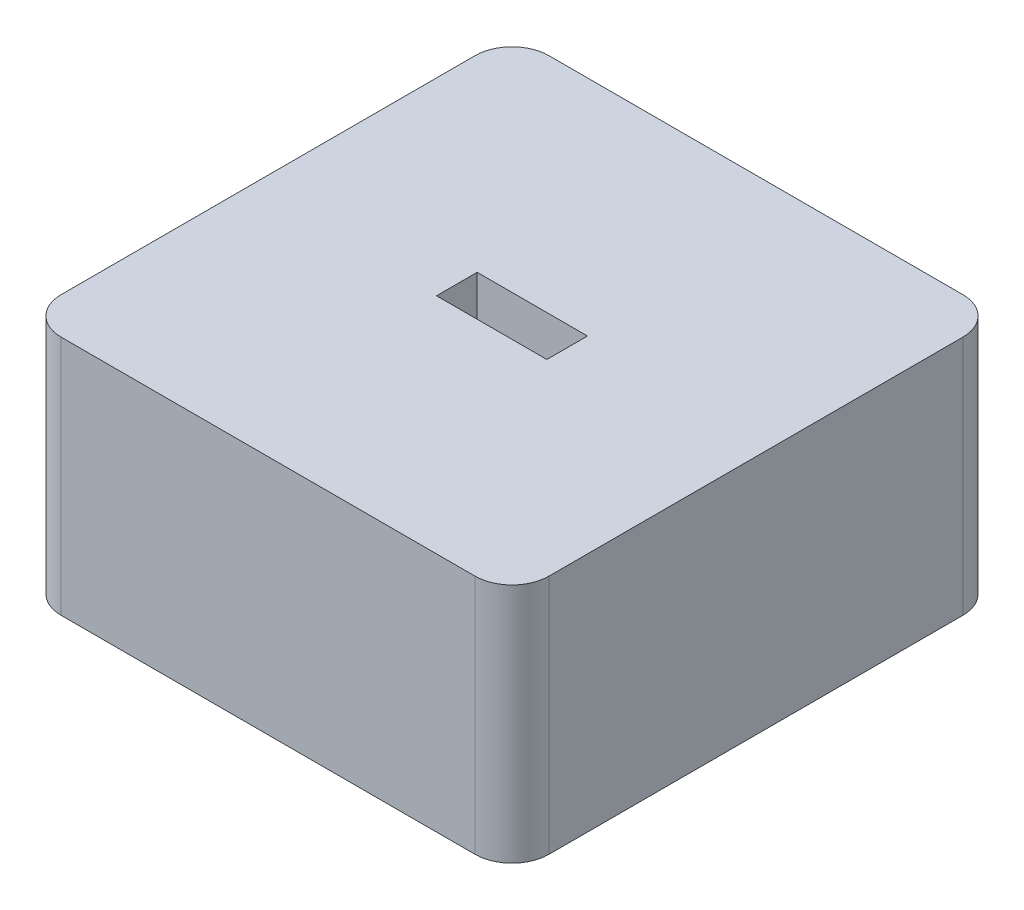
from build123d import *

# Parameters (mm, degrees)
SKETCH1_W           = 42
SKETCH1_H           = 42
BOSS_EXTRUDE1_DEPTH = 20.75
SKETCH2_W           = 9.5
SKETCH2_H           = 3.5
CUT_EXTRUDE4_DEPTH  = 3.52
SKETCH3_W           = 15.5
SKETCH3_H           = 10.5
CUT_EXTRUDE1_DEPTH  = 15.23
CUT_EXTRUDE2_REACH  = 63.846
SKETCH5_W           = 34
SKETCH5_H           = 34
SKETCH5_W_2         = 21.5
SKETCH5_H_2         = 16.5
CUT_EXTRUDE5_DEPTH  = 10
FILLET1_R           = 3.175


with BuildPart() as part:
    # Sketch1 → Boss-Extrude1 (new body)
    with BuildSketch(Plane(origin=(0, 0, 0), x_dir=(1, 0, 0), z_dir=(0, 1, 0))):
        with Locations((21, 21)):
            Rectangle(SKETCH1_W, SKETCH1_H)
    extrude(amount=BOSS_EXTRUDE1_DEPTH)

    # Sketch2 → Cut-Extrude4 (cut)
    with BuildSketch(Plane(origin=(0, 20.75, 0), x_dir=(1, 0, 0), z_dir=(0, 1, 0))):
        with Locations((21, 21)):
            Rectangle(SKETCH2_W, SKETCH2_H)
    extrude(amount=-CUT_EXTRUDE4_DEPTH, mode=Mode.SUBTRACT)

    # Sketch3 → Cut-Extrude1 (cut)
    with BuildSketch(Plane.XZ):
        with Locations((21, -21)):
            Rectangle(SKETCH3_W, SKETCH3_H)
    extrude(amount=-CUT_EXTRUDE1_DEPTH, mode=Mode.SUBTRACT)

    # Sketch4 → Cut-Extrude2 (cut, up to next)
    with BuildSketch(Plane(origin=(0, 17.23, 0), x_dir=(1, 0, 0), z_dir=(0, 1, 0)), mode=Mode.PRIVATE) as cut_extrude2_sk1:
        with BuildLine():
            Line((17.975, 22.275), (24.025, 22.275))
            ThreePointArc((24.025, 22.275), (25.3, 21), (24.025, 19.725))
            Line((24.025, 19.725), (17.975, 19.725))
            ThreePointArc((17.975, 19.725), (16.7, 21), (17.975, 22.275))
        make_face()
    cut_extrude2_tool1 = extrude(cut_extrude2_sk1.sketch, amount=-CUT_EXTRUDE2_REACH, mode=Mode.PRIVATE) & part.part
    add(cut_extrude2_tool1.solids().sort_by_distance((21, 17.23, -21))[0], mode=Mode.SUBTRACT)

    # Sketch5 → Cut-Extrude5 (cut)
    with BuildSketch(Plane.XZ):
        with Locations((21, -21)):
            Rectangle(SKETCH5_W, SKETCH5_H)
        with Locations((21, -21)):
            Rectangle(SKETCH5_W_2, SKETCH5_H_2, mode=Mode.SUBTRACT)
    extrude(amount=-CUT_EXTRUDE5_DEPTH, mode=Mode.SUBTRACT)

    # Fillet1
    fillet1_edges = [part.edges().sort_by_distance(p)[0] for p in [
        (42, 10.375, -42),
        (42, 10.375, 0),
        (0, 10.375, 0),
        (0, 10.375, -42),
    ]]
    fillet(fillet1_edges, radius=FILLET1_R)


solid = part.part
